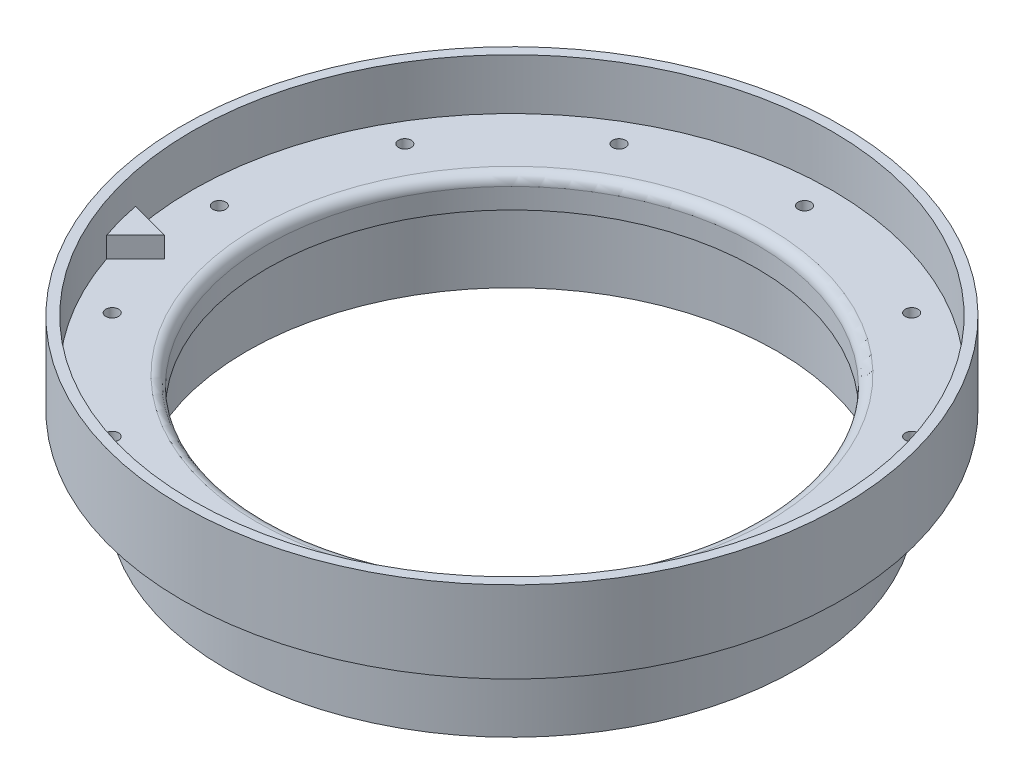
from build123d import *

# Parameters (mm, degrees)
F_3_48_TAPPED_HOLE1_D = 1.9939
CIRPATTERN1_COUNT     = 12
BOSS_EXTRUDE1_DEPTH   = 3.175


with BuildPart() as part:
    # Cross Section → Main (revolve)
    with BuildSketch(Plane.XY):
        with BuildLine():
            Line((-38.1508, 0), (-38.1508, -3.175))
            Line((-38.1508, -3.175), (-41.275, -3.175))
            Line((-41.275, -3.175), (-41.275, -15.875))
            Line((-41.275, -15.875), (-44.45, -15.875))
            Line((-44.45, -15.875), (-44.45, -3.175))
            Line((-44.45, -3.175), (-51.308, -3.175))
            Line((-51.308, -3.175), (-51.308, 9.525))
            Line((-51.308, 9.525), (-49.784, 9.525))
            Line((-49.784, 9.525), (-49.784, 1.5875))
            Line((-49.784, 1.5875), (-39.7383, 1.5875))
            ThreePointArc((-39.7383, 1.5875), (-38.615767985, 1.122532015), (-38.1508, 0))
        make_face()
    revolve(axis=Axis((0, 55, 0), (0, -1, 0)))

    # #3-48 Tapped Hole1 (through all)
    with Locations(Plane(origin=(0, 1.5875, 0), x_dir=(1, 0, 0), z_dir=(0, 1, 0))):
        with Locations((-45.5549, 0)):
            f_3_48_tapped_hole1 = Hole(F_3_48_TAPPED_HOLE1_D / 2)

    # CirPattern1: #3-48 Tapped Hole1 ×12 about axis
    cirpattern1_axis = Axis((0, 0, 0), (0, -1, 0))
    for i in range(1, CIRPATTERN1_COUNT):
        add(f_3_48_tapped_hole1.rotate(cirpattern1_axis, i * 360 / CIRPATTERN1_COUNT), mode=Mode.SUBTRACT)

    # Sketch3 → Boss-Extrude1 (add)
    with BuildSketch(Plane(origin=(0, 1.5875, 0), x_dir=(1, 0, 0), z_dir=(0, 1, 0))):
        with BuildLine():
            Line((-47.168007396, -15.925631363), (-42.677879335, -11.435503303))
            Line((-42.677879335, -11.435503303), (-48.811508332, -9.792002366))
            ThreePointArc((-48.811508332, -9.792002366), (-48.087651336, -12.885047341), (-47.168007396, -15.925631363))
        make_face()
    extrude(amount=BOSS_EXTRUDE1_DEPTH)


solid = part.part
